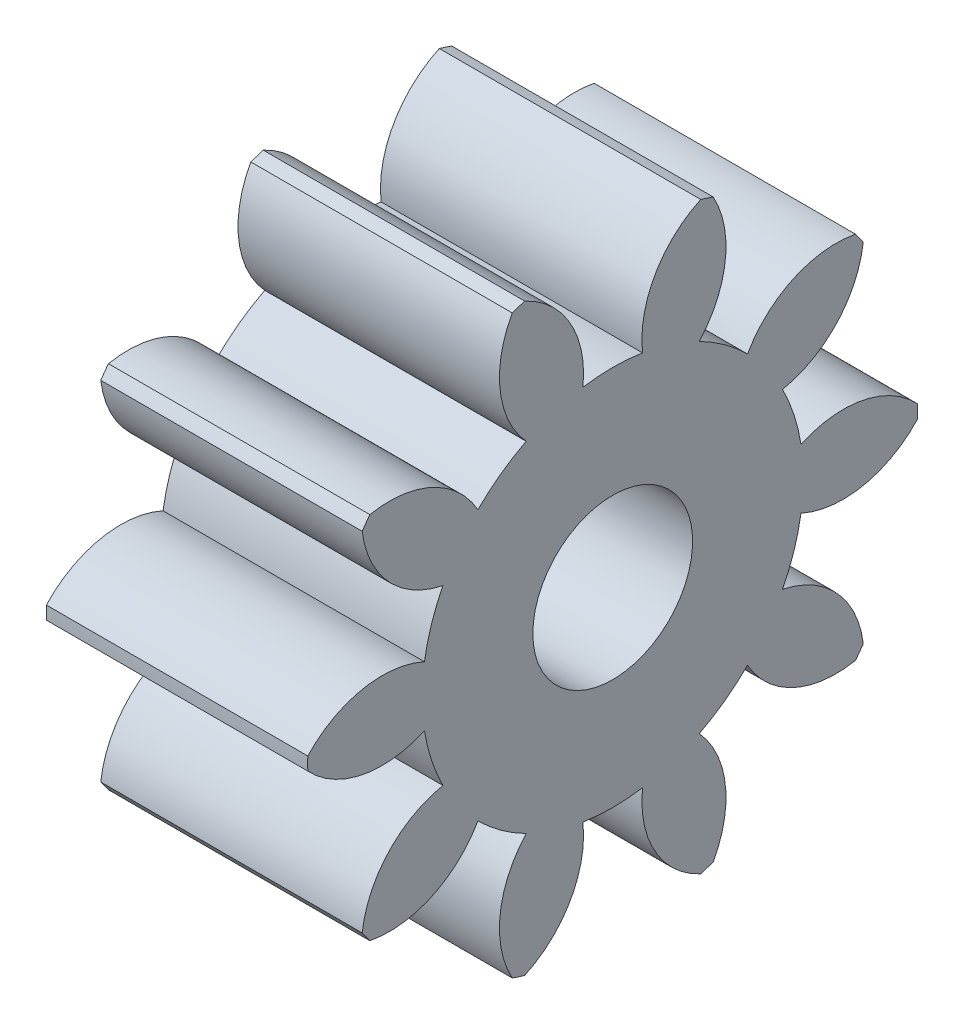
from build123d import *

# Parameters (mm, degrees)
BASPROSKE_W     = 18
BASPROSKE_H     = 21
TOOTHCUT_DEPTH  = 35.727510708
TEETHCUTS_COUNT = 10
TEETHCUTS_ANGLE = 324
BORSKE_R        = 5.5
BORE_DEPTH      = 50.0000508


with BuildPart() as part:
    # BasProSke → Base-Revolve (revolve)
    with BuildSketch(Plane(origin=(0, 0, 0), x_dir=(1, 0, 0), z_dir=(0, 1, 0))):
        with Locations((9, 10.5)):
            Rectangle(BASPROSKE_W, BASPROSKE_H)
    revolve(axis=Axis((-10, 0, 0), (1, 0, 0)))

    # TooCutSke → ToothCut (cut, through all)
    with BuildSketch(Plane(origin=(0, 0, 0), x_dir=(0, 0, -1), z_dir=(1, 0, 0))):
        with BuildLine():
            ThreePointArc((2.053493716, 12.96235085), (0, 13.124), (-2.053493716, 12.96235085))
            ThreePointArc((-2.053493716, 12.96235085), (-2.911994173, 17.198355829), (-6.094590762, 20.122708779))
            ThreePointArc((-6.094590762, 20.122708779), (0, 21.0254), (6.094590762, 20.122708779))
            ThreePointArc((6.094590762, 20.122708779), (2.911994173, 17.198355829), (2.053493716, 12.96235085))
        make_face()
    toothcut = extrude(amount=TOOTHCUT_DEPTH, mode=Mode.SUBTRACT)

    # TeethCuts: ToothCut ×10 about axis
    teethcuts_axis = Axis((-10, 0, 0), (1, 0, 0))
    for i in range(1, TEETHCUTS_COUNT):
        add(toothcut.rotate(teethcuts_axis, i * TEETHCUTS_ANGLE / (TEETHCUTS_COUNT - 1)), mode=Mode.SUBTRACT)

    # BorSke → Bore (cut, symmetric)
    with BuildSketch(Plane(origin=(0, 0, 0), x_dir=(0, 0, -1), z_dir=(1, 0, 0))):
        Circle(BORSKE_R)
    extrude(amount=BORE_DEPTH, both=True, mode=Mode.SUBTRACT)


solid = part.part
